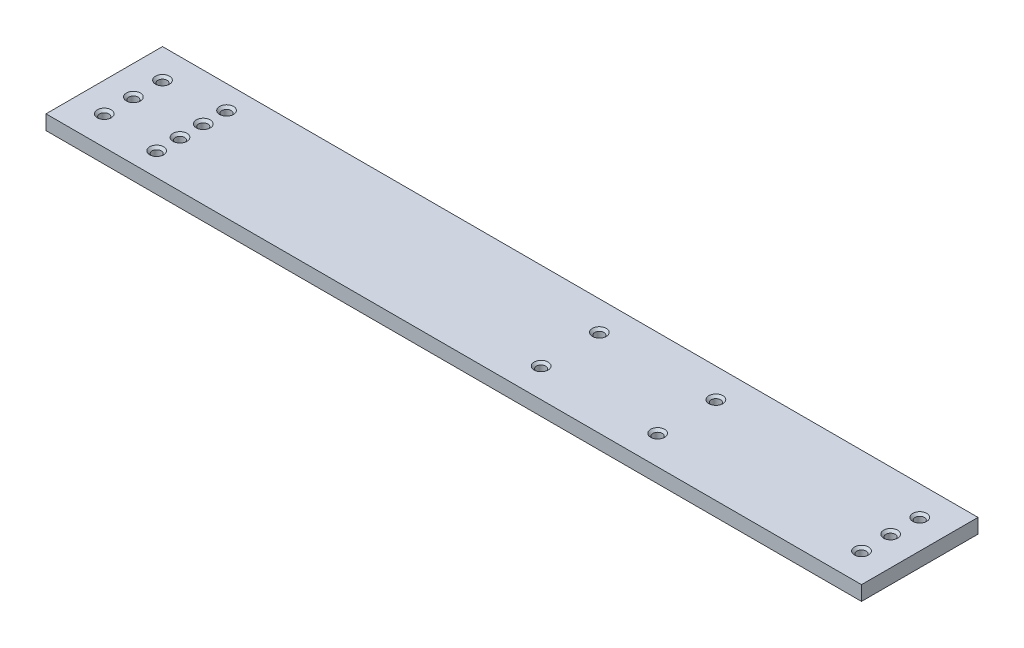
from build123d import *

# Parameters (mm, degrees)
SKETCH1_W                        = 355.6
SKETCH1_H                        = 50.8
BOSS_EXTRUDE1_DEPTH              = 6.35
F_10_32_TAPPED_HOLE1_D           = 4.0386
F_10_32_TAPPED_HOLE1_CSINK_D     = 6.096
F_10_32_TAPPED_HOLE1_CSINK_ANGLE = 90


with BuildPart() as part:
    # Sketch1 → Boss-Extrude1 (new body)
    with BuildSketch(Plane(origin=(0, 0, 0), x_dir=(1, 0, 0), z_dir=(0, 1, 0))):
        Rectangle(SKETCH1_W, SKETCH1_H)
    extrude(amount=BOSS_EXTRUDE1_DEPTH)

    # #10-32 Tapped Hole1 (through all)
    with Locations(Plane(origin=(0, 6.35, 0), x_dir=(1, 0, 0), z_dir=(0, 1, 0))):
        with Locations((-165.1, 12.7), (-165.1, 0), (-165.1, -12.7), (165.1, 12.7), (165.1, 0), (165.1, -12.7), (25.4, 12.7), (76.2, 12.7), (25.4, -12.7), (76.2, -12.7), (-139.7, 15.24), (-139.7, 5.08), (-139.7, -15.24), (-139.7, -5.08)):
            CounterSinkHole(F_10_32_TAPPED_HOLE1_D / 2, F_10_32_TAPPED_HOLE1_CSINK_D / 2, counter_sink_angle=F_10_32_TAPPED_HOLE1_CSINK_ANGLE)


solid = part.part
